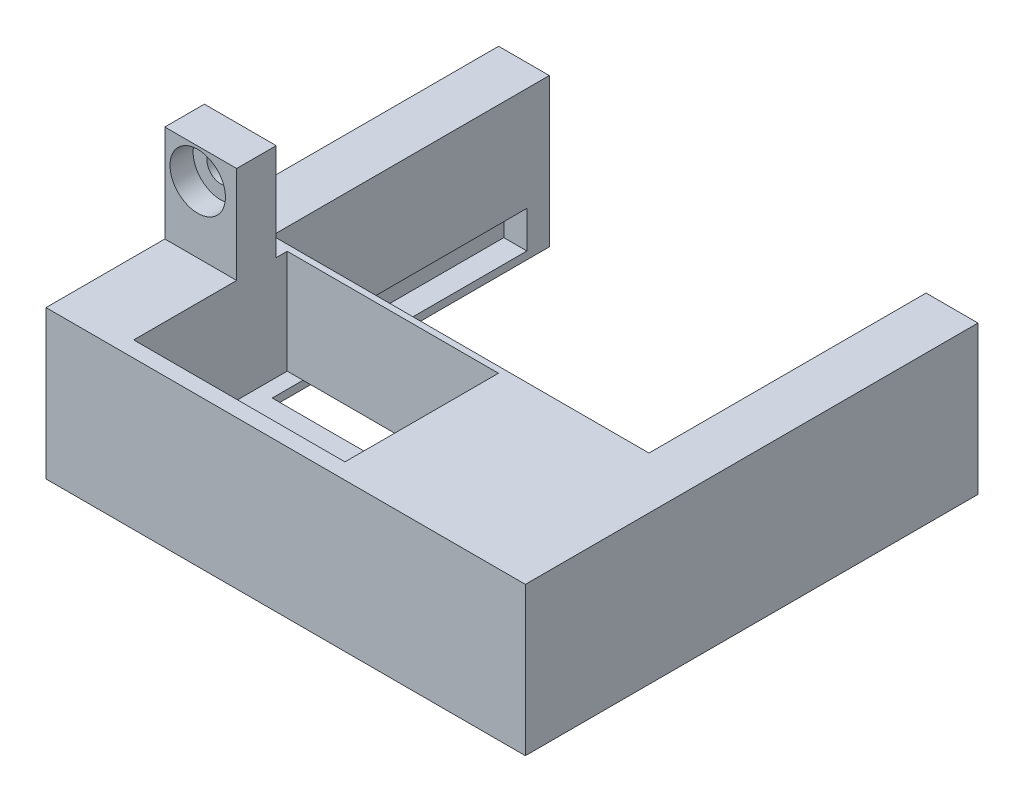
from build123d import *

# Parameters (mm, degrees)
SKETCH2_W           = 51.895920804
SKETCH2_H           = 16.069458603
BOSS_EXTRUDE1_DEPTH = 49
SKETCH3_W           = 40.788974389
SKETCH3_H           = 16.069458603
CUT_EXTRUDE1_DEPTH  = 30
SKETCH4_W           = 22.869815576
SKETCH4_H           = 16.619980412
CUT_EXTRUDE2_DEPTH  = 14
SKETCH5_W           = 26
SKETCH5_H           = 4
CUT_EXTRUDE3_DEPTH  = 2.5
SKETCH12_W          = 27.575464798
SKETCH12_H          = 4
CUT_EXTRUDE6_DEPTH  = 2.5
SKETCH15_W          = 45.788974389
SKETCH15_H          = 4
CUT_EXTRUDE7_DEPTH  = 17.5
SKETCH17_W          = 7.778908367
SKETCH17_H          = 4.284963324
BOSS_EXTRUDE2_DEPTH = 10.5
SKETCH18_R          = 1.5
CUT_EXTRUDE8_DEPTH  = 5
SKETCH19_R          = 3
CUT_EXTRUDE9_DEPTH  = 2.5


with BuildPart() as part:
    # Sketch2 → Boss-Extrude1 (new body)
    with BuildSketch(Plane.XY):
        with Locations((-27.854725768, 8.20304675)):
            Rectangle(SKETCH2_W, SKETCH2_H)
    extrude(amount=BOSS_EXTRUDE1_DEPTH)

    # Sketch3 → Cut-Extrude1 (cut)
    with BuildSketch(Plane(origin=(0, 0, 0), x_dir=(-1, 0, 0), z_dir=(0, 0, -1))):
        with Locations((27.921471274, 8.20304675)):
            Rectangle(SKETCH3_W, SKETCH3_H)
    extrude(amount=-CUT_EXTRUDE1_DEPTH, mode=Mode.SUBTRACT)

    # Sketch4 → Cut-Extrude2 (cut)
    with BuildSketch(Plane(origin=(0, 16.237776051, 0), x_dir=(1, 0, 0), z_dir=(0, 1, 0))):
        with Locations((-34.588870015, -38.97443395)):
            Rectangle(SKETCH4_W, SKETCH4_H)
    extrude(amount=-CUT_EXTRUDE2_DEPTH, mode=Mode.SUBTRACT)

    # Sketch5 → Cut-Extrude3 (cut)
    with BuildSketch(Plane.ZY.offset(7.52698408)):
        with Locations((17, 3)):
            Rectangle(SKETCH5_W, SKETCH5_H)
    extrude(amount=-CUT_EXTRUDE3_DEPTH, mode=Mode.SUBTRACT)

    # Sketch12 → Cut-Extrude6 (cut)
    with BuildSketch(Plane(origin=(-48.315958469, 0, 0), x_dir=(0, 0, -1), z_dir=(1, 0, 0))):
        with Locations((-16.212267601, 3)):
            Rectangle(SKETCH12_W, SKETCH12_H)
    extrude(amount=-CUT_EXTRUDE6_DEPTH, mode=Mode.SUBTRACT)

    # Sketch15 → Cut-Extrude7 (cut)
    with BuildSketch(Plane(origin=(0, 0, 30), x_dir=(-1, 0, 0), z_dir=(0, 0, -1))):
        with Locations((27.921471274, 3)):
            Rectangle(SKETCH15_W, SKETCH15_H)
    extrude(amount=-CUT_EXTRUDE7_DEPTH, mode=Mode.SUBTRACT)

    # Sketch17 → Boss-Extrude2 (add)
    with BuildSketch(Plane(origin=(0, 16.237776051, 0), x_dir=(1, 0, 0), z_dir=(0, 1, 0))):
        with Locations((-49.913231987, -33.995977251)):
            Rectangle(SKETCH17_W, SKETCH17_H)
    extrude(amount=BOSS_EXTRUDE2_DEPTH)

    # Sketch18 → Cut-Extrude8 (cut)
    with BuildSketch(Plane.XY.offset(36.138458913)):
        with Locations((-50.239621596, 23.429782287)):
            Circle(SKETCH18_R)
    extrude(amount=-CUT_EXTRUDE8_DEPTH, mode=Mode.SUBTRACT)

    # Sketch19 → Cut-Extrude9 (cut)
    with BuildSketch(Plane.XY.offset(36.138458913)):
        with Locations((-50.239621596, 23.429782287)):
            Circle(SKETCH19_R)
    extrude(amount=-CUT_EXTRUDE9_DEPTH, mode=Mode.SUBTRACT)


solid = part.part
